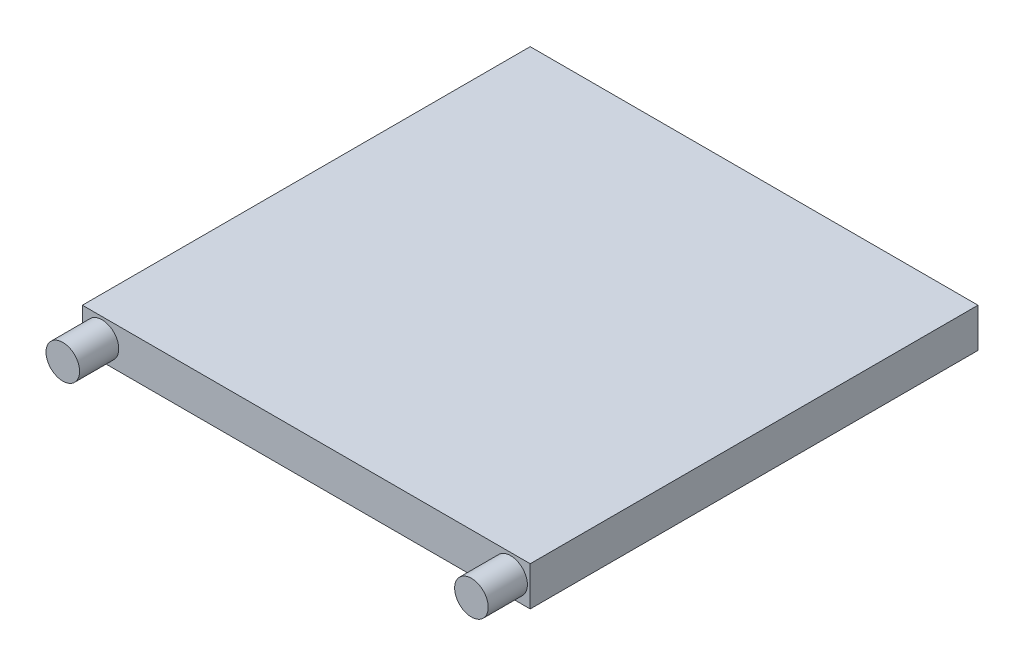
from build123d import *

# Parameters (mm, degrees)
SKETCH1_W           = 40
SKETCH1_H           = 40
BOSS_EXTRUDE1_DEPTH = 3.5
SKETCH2_R           = 1.5
BOSS_EXTRUDE2_DEPTH = 3.5


with BuildPart() as part:
    # Sketch1 → Boss-Extrude1 (new body)
    with BuildSketch(Plane(origin=(0, 0, 0), x_dir=(1, 0, 0), z_dir=(0, 1, 0))):
        Rectangle(SKETCH1_W, SKETCH1_H)
    extrude(amount=BOSS_EXTRUDE1_DEPTH)

    # Sketch2 → Boss-Extrude2 (add)
    with BuildSketch(Plane.XY.offset(20)):
        with Locations((-18.25, 1.75)):
            Circle(SKETCH2_R)
        with Locations((18.25, 1.75)):
            Circle(SKETCH2_R)
    extrude(amount=BOSS_EXTRUDE2_DEPTH)


solid = part.part
